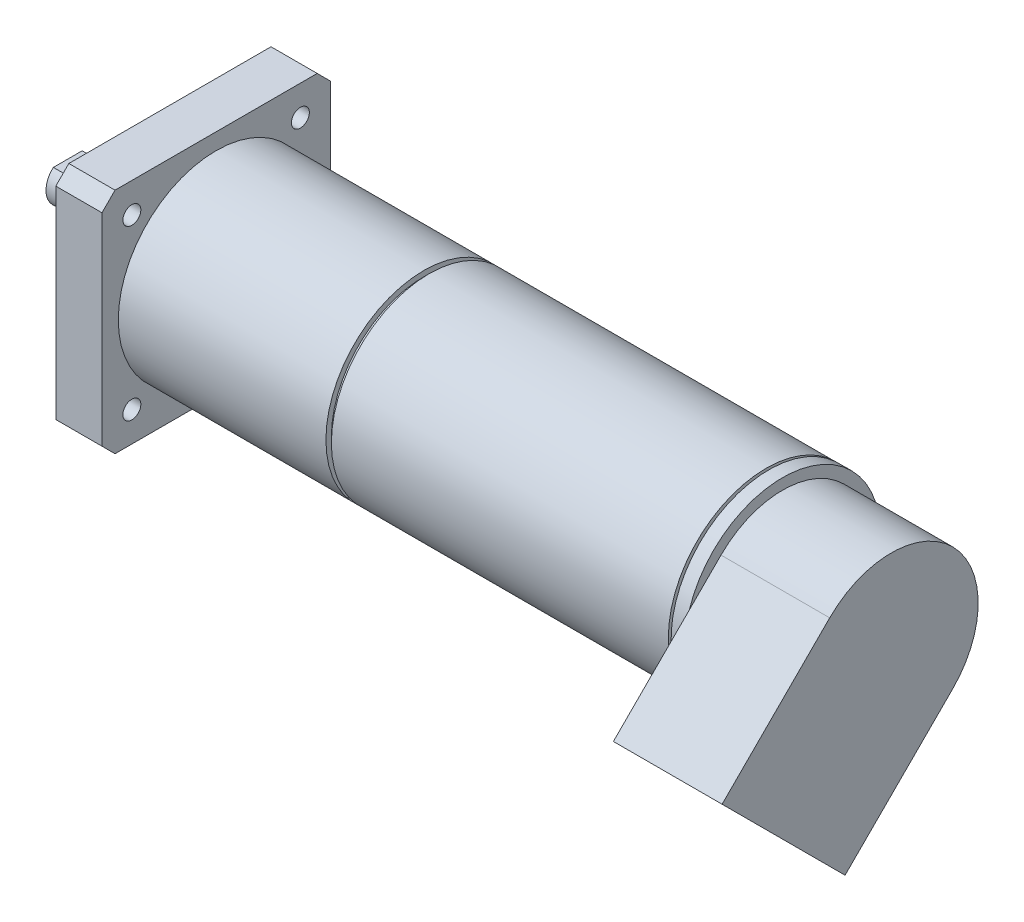
from build123d import *

# Parameters (mm, degrees)
SKETCH_1_W                 = 42
SKETCH_1_H                 = 42
EXTRUDE_1_DEPTH            = 8.5
SKETCH_2_R                 = 47.208301361
CUT_EXTRUDE_1_DEPTH        = 8.5
SKETCH_3_R                 = 11
EXTRUDE_2_DEPTH            = 2
SKETCH_4_R                 = 4
EXTRUDE_3_DEPTH            = 16.8
CUT_EXTRUDE_START          = -15
CUT_EXTRUDE_2_DEPTH        = 15
SKETCH_7_R                 = 18
EXTRUDE_4_DEPTH            = 101.2
SKETCH_8_R                 = 16.5
EXTRUDE_5_DEPTH            = 0.5
EXTRUDE_START              = 2.5
SKETCH_9_R                 = 18
EXTRUDE_6_DEPTH            = 2.5
EXTRUDE_7_DEPTH            = 20
HOLE_WIZARD_M4_1_D         = 3.3
PATTERN_LINEAR_1_OUTLINE_R = 1.65
PATTERN_LINEAR_1_DEPTH     = 8.5
SKETCH_13_W                = 1
SKETCH_13_H                = 1


# Read off the part's stored shape, not the designer's step: 阵列(线性)1
with BuildPart() as part:
    # 草图1 → 凸台-拉伸1 (new body)
    with BuildSketch(Plane(origin=(0, 0, 0), x_dir=(0, 0, -1), z_dir=(1, 0, 0))):
        Rectangle(SKETCH_1_W, SKETCH_1_H)
    extrude(amount=EXTRUDE_1_DEPTH)

    # 草图2 → 切除-拉伸1 (cut)
    with BuildSketch(Plane.ZY):
        Circle(SKETCH_2_R)
        Polygon((39.597979746, 0), (0, 39.597979746), (-39.597979746, 0), (0, -39.597979746), align=None, mode=Mode.SUBTRACT)
    extrude(amount=-CUT_EXTRUDE_1_DEPTH, mode=Mode.SUBTRACT)

    # 草图3 → 凸台-拉伸2 (add)
    with BuildSketch(Plane.ZY):
        Circle(SKETCH_3_R)
    extrude(amount=EXTRUDE_2_DEPTH)

    # 草图4 → 凸台-拉伸3 (add)
    with BuildSketch(Plane.ZY.offset(2)):
        Circle(SKETCH_4_R)
    extrude(amount=EXTRUDE_3_DEPTH)

    # 草图5 → 切除-拉伸2 (cut)
    with BuildSketch(Plane.ZY.offset(18.8).offset(CUT_EXTRUDE_START)):
        with BuildLine():
            Line((-2.645751311, 3), (2.645751311, 3))
            ThreePointArc((2.645751311, 3), (0, 4), (-2.645751311, 3))
        make_face()
    extrude(amount=CUT_EXTRUDE_2_DEPTH, mode=Mode.SUBTRACT)

    # 草图7 → 凸台-拉伸4 (add)
    with BuildSketch(Plane.ZY.offset(-109.7)):
        Circle(SKETCH_7_R)
    extrude(amount=EXTRUDE_4_DEPTH)

    # 草图8 → 凸台-拉伸5 (add)
    with BuildSketch(Plane(origin=(109.7, 0, 0), x_dir=(0, 0, -1), z_dir=(1, 0, 0))):
        Circle(SKETCH_8_R)
    extrude(amount=EXTRUDE_5_DEPTH)

    # 草图9 → 凸台-拉伸6 (add)
    with BuildSketch(Plane(origin=(110.2, 0, 0), x_dir=(0, 0, -1), z_dir=(1, 0, 0)).offset(EXTRUDE_START)):
        with Locations(Location((0, 0, 0), (0, 0, 180))):
            Circle(SKETCH_9_R)
    extrude(amount=-EXTRUDE_6_DEPTH)

    # 草图10 → 凸台-拉伸7 (add)
    with BuildSketch(Plane(origin=(112.7, 0, 0), x_dir=(0, 0, -1), z_dir=(1, 0, 0))):
        with BuildLine():
            Line((-11.313708499, 11.313708499), (-31.112698372, -8.485281374))
            Line((-31.112698372, -8.485281374), (-8.485281374, -31.112698372))
            Line((-8.485281374, -31.112698372), (11.313708499, -11.313708499))
            ThreePointArc((11.313708499, -11.313708499), (11.313708499, 11.313708499), (-11.313708499, 11.313708499))
        make_face()
    extrude(amount=EXTRUDE_7_DEPTH)

    # M4 螺纹孔1 (through all)
    with Locations(Plane(origin=(0, 15.5, -15.5), x_dir=(0, 0, -1), z_dir=(-1, 0, 0))):
        with Locations((0, 0)):
            Hole(HOLE_WIZARD_M4_1_D / 2)

    # 阵列(线性)1 outline → 阵列(线性)1 (cut)
    with BuildSketch(Plane.YZ):
        with Locations((-15.5, -15.5)):
            Circle(PATTERN_LINEAR_1_OUTLINE_R)
        with Locations((15.5, 15.5)):
            Circle(PATTERN_LINEAR_1_OUTLINE_R)
        with Locations((-15.5, 15.5)):
            Circle(PATTERN_LINEAR_1_OUTLINE_R)
    extrude(amount=PATTERN_LINEAR_1_DEPTH, mode=Mode.SUBTRACT)

    # 草图13 → 切除-旋转1 (revolve, cut)
    with BuildSketch(Plane(origin=(0, 0, 0), x_dir=(1, 0, 0), z_dir=(0, 1, 0)), mode=Mode.PRIVATE) as cut_revolve_1_sk:
        with Locations((47.2, 17.5)):
            Rectangle(SKETCH_13_W, SKETCH_13_H)
    revolve(cut_revolve_1_sk.sketch.rotate(Axis((8.5, 0, 0), (1, 0, 0)), 180), axis=Axis((8.5, 0, 0), (1, 0, 0)), mode=Mode.SUBTRACT)


solid = part.part
